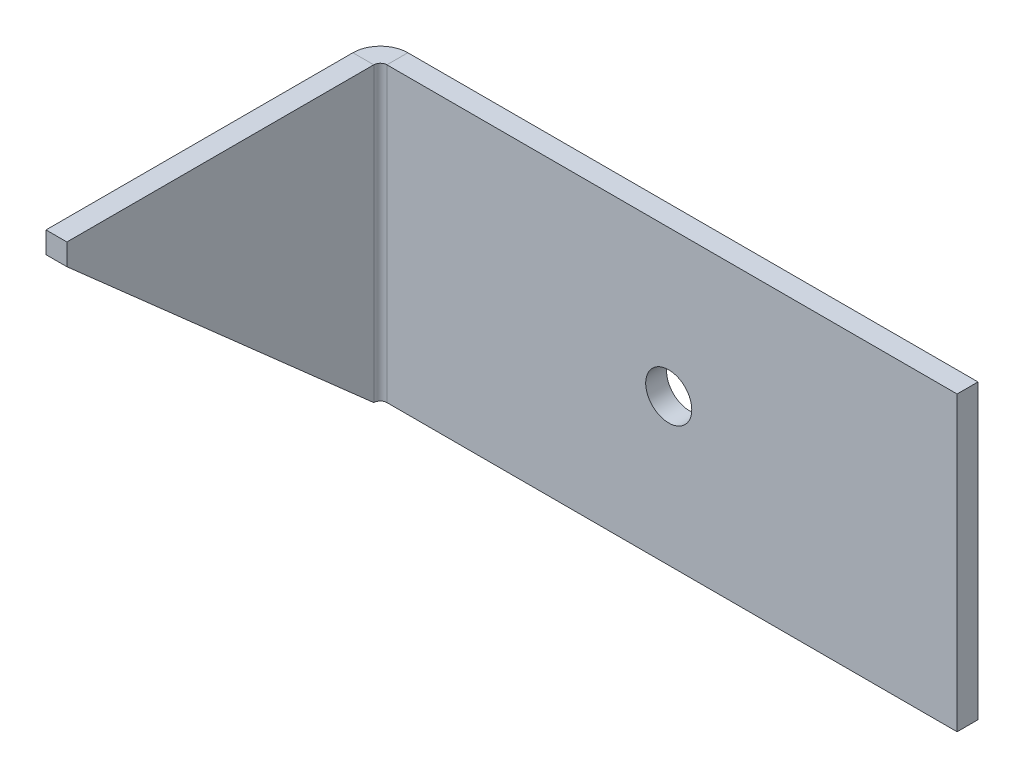
from build123d import *

# Parameters (mm, degrees)
SKETCH1_W                    = 90.805
SKETCH1_H                    = 44.45
BASE_FLANGE1_DEPTH           = 3.175
EDGE_FLANGE1_STRIP_W         = 14.7
EDGE_FLANGE1_STRIP_H         = 3.175
EDGE_FLANGE1_STRIP_CUT_DEPTH = 44.45
EDGE_FLANGE1_DEPTH           = 44.45
CUT_EXTRUDE1_DEPTH           = 107.396140203
CUT_EXTRUDE1_DEPTH_BACK      = 3.175
M6_CLEARANCE_HOLE3_D         = 7


# Sheet-metal steps are written as plain solids
with BuildPart() as part:
    # Sketch1 → Base-Flange1 (new body)
    with BuildSketch(Plane.XY):
        Rectangle(SKETCH1_W, SKETCH1_H)
    extrude(amount=BASE_FLANGE1_DEPTH)

    # Edge-Flange1 strip (across the edge) → Edge-Flange1 strip cut (cut)
    with BuildSketch(Plane(origin=(-45.4025, 22.225, 3.175), x_dir=(1, 0, 0), z_dir=(0, -1, 0))):
        with Locations((-3.175, -1.5875)):
            Rectangle(EDGE_FLANGE1_STRIP_W, EDGE_FLANGE1_STRIP_H)
    extrude(amount=EDGE_FLANGE1_STRIP_CUT_DEPTH, mode=Mode.SUBTRACT)

    # Edge-Flange1 section (across the edge) → Edge-Flange1 (add)
    with BuildSketch(Plane(origin=(-45.4025, 22.225, 3.175), x_dir=(1, 0, 0), z_dir=(0, -1, 0))):
        with BuildLine():
            Line((0, 1), (0, 47.625))
            Line((0, 47.625), (3.175, 47.625))
            Line((3.175, 47.625), (3.175, 1))
            ThreePointArc((3.175, 1), (3.467893219, 0.292893219), (4.175, 0))
            Line((4.175, 0), (4.175, -3.175))
            ThreePointArc((4.175, -3.175), (1.222829189, -1.952170811), (0, 1))
        make_face()
    extrude(amount=EDGE_FLANGE1_DEPTH)

    # Sketch9 → Cut-Extrude1 (cut, two sides: drawn at the far end of the back side and taken through both)
    with BuildSketch(Plane.ZY.offset(45.4025).offset(-CUT_EXTRUDE1_DEPTH_BACK)):
        Polygon((50.8, 167.227851822), (50.8, 22.225), (50.8, 18.96237), (4.175, -22.225), (-104.498494033, -118.224472556), (150.247183568, -256.81721367), (305.545677601, 28.635110708), align=None)
    extrude(amount=CUT_EXTRUDE1_DEPTH + CUT_EXTRUDE1_DEPTH_BACK, mode=Mode.SUBTRACT)

    # M6 Clearance Hole3 (through all)
    with Locations(Plane.XY.offset(3.175)):
        with Locations((1.5875, 0)):
            Hole(M6_CLEARANCE_HOLE3_D / 2)


solid = part.part
